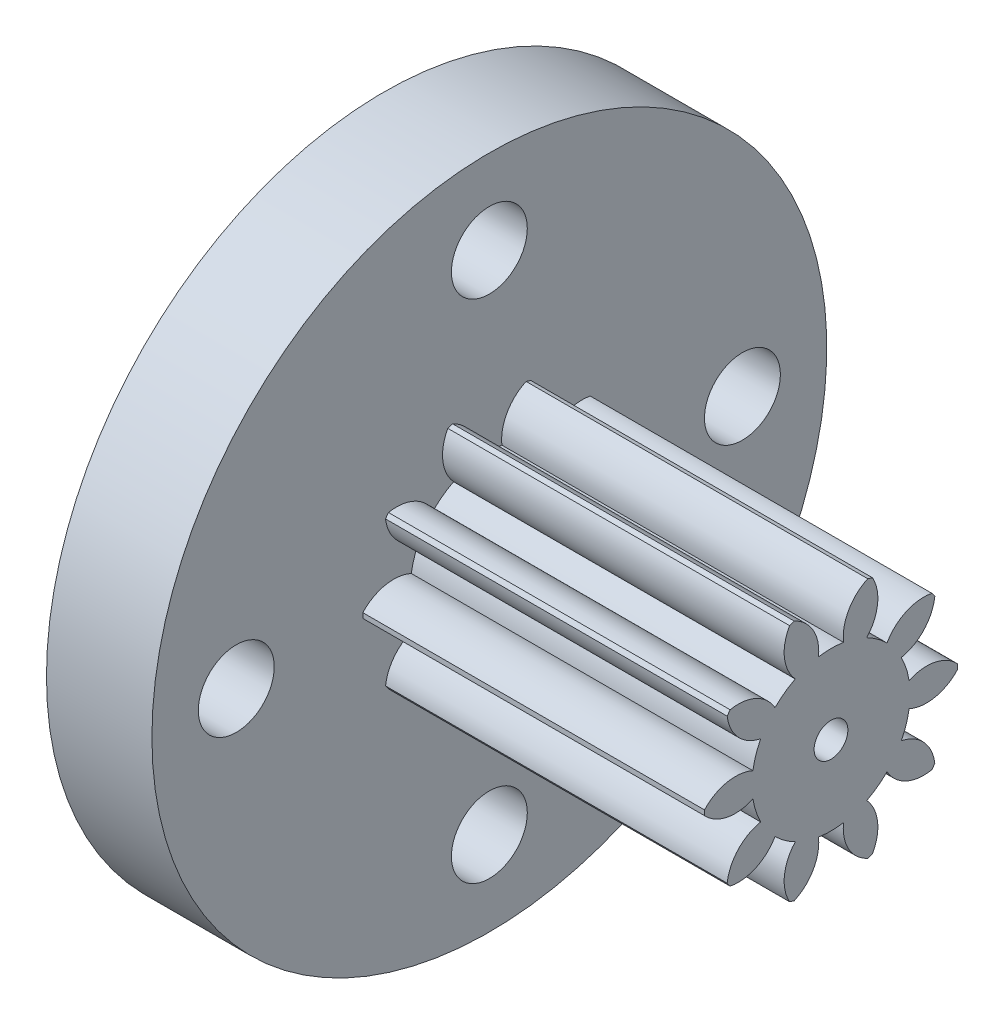
from build123d import *

# Parameters (mm, degrees)
BASPROSKE_W                = 10.6
BASPROSKE_H                = 3
TOOTHCUT_DEPTH             = 12.417530381
TEETHCUTS_COUNT            = 10
BORSKE_R                   = 0.4
BORE_DEPTH                 = 50.0000508
SKETCH1_R                  = 8
BOSS_EXTRUDE1_DEPTH        = 2.5
M1_6_CLEARANCE_HOLE1_D     = 1.8
M1_6_CLEARANCE_HOLE1_DEPTH = 4.25
M1_6_CLEARANCE_HOLE1_TIP   = 0.540774557


with BuildPart() as part:
    # BasProSke → Base-Revolve (revolve)
    with BuildSketch(Plane(origin=(0, 0, 0), x_dir=(1, 0, 0), z_dir=(0, 1, 0))):
        with Locations((5.3, 1.5)):
            Rectangle(BASPROSKE_W, BASPROSKE_H)
    revolve(axis=Axis((-10, 0, 0), (1, 0, 0)))

    # TooCutSke → ToothCut (cut, through all)
    with BuildSketch(Plane(origin=(0, 0, 0), x_dir=(0, 0, -1), z_dir=(1, 0, 0))):
        with BuildLine():
            ThreePointArc((0.296449938, 1.850403587), (0, 1.874), (-0.296449938, 1.850403587))
            ThreePointArc((-0.296449938, 1.850403587), (-0.428089565, 2.470295585), (-0.905889751, 2.886591228))
            ThreePointArc((-0.905889751, 2.886591228), (0, 3.0254), (0.905889751, 2.886591228))
            ThreePointArc((0.905889751, 2.886591228), (0.428089565, 2.470295585), (0.296449938, 1.850403587))
        make_face()
    toothcut = extrude(amount=TOOTHCUT_DEPTH, mode=Mode.SUBTRACT)

    # TeethCuts: ToothCut ×10 about axis
    teethcuts_axis = Axis((-10, 0, 0), (1, 0, 0))
    for i in range(1, TEETHCUTS_COUNT):
        add(toothcut.rotate(teethcuts_axis, i * 360 / TEETHCUTS_COUNT), mode=Mode.SUBTRACT)

    # BorSke → Bore (cut, symmetric)
    with BuildSketch(Plane(origin=(0, 0, 0), x_dir=(0, 0, -1), z_dir=(1, 0, 0))):
        Circle(BORSKE_R)
    extrude(amount=BORE_DEPTH, both=True, mode=Mode.SUBTRACT)

    # Sketch1 → Boss-Extrude1 (add)
    with BuildSketch(Plane.ZY):
        Circle(SKETCH1_R)
    extrude(amount=-BOSS_EXTRUDE1_DEPTH)

    # M1.6 Clearance Hole1
    with Locations(Plane(origin=(2.5, 0, 0), x_dir=(0, 0, -1), z_dir=(1, 0, 0))):
        with Locations((0, 6), (6, 0), (0, -6), (-6, 0)):
            Hole(M1_6_CLEARANCE_HOLE1_D / 2, depth=M1_6_CLEARANCE_HOLE1_DEPTH)
            with Locations((0, 0, -(M1_6_CLEARANCE_HOLE1_DEPTH + M1_6_CLEARANCE_HOLE1_TIP / 2))):  # 118° drill point
                Cone(0, M1_6_CLEARANCE_HOLE1_D / 2, M1_6_CLEARANCE_HOLE1_TIP, mode=Mode.SUBTRACT)


solid = part.part
